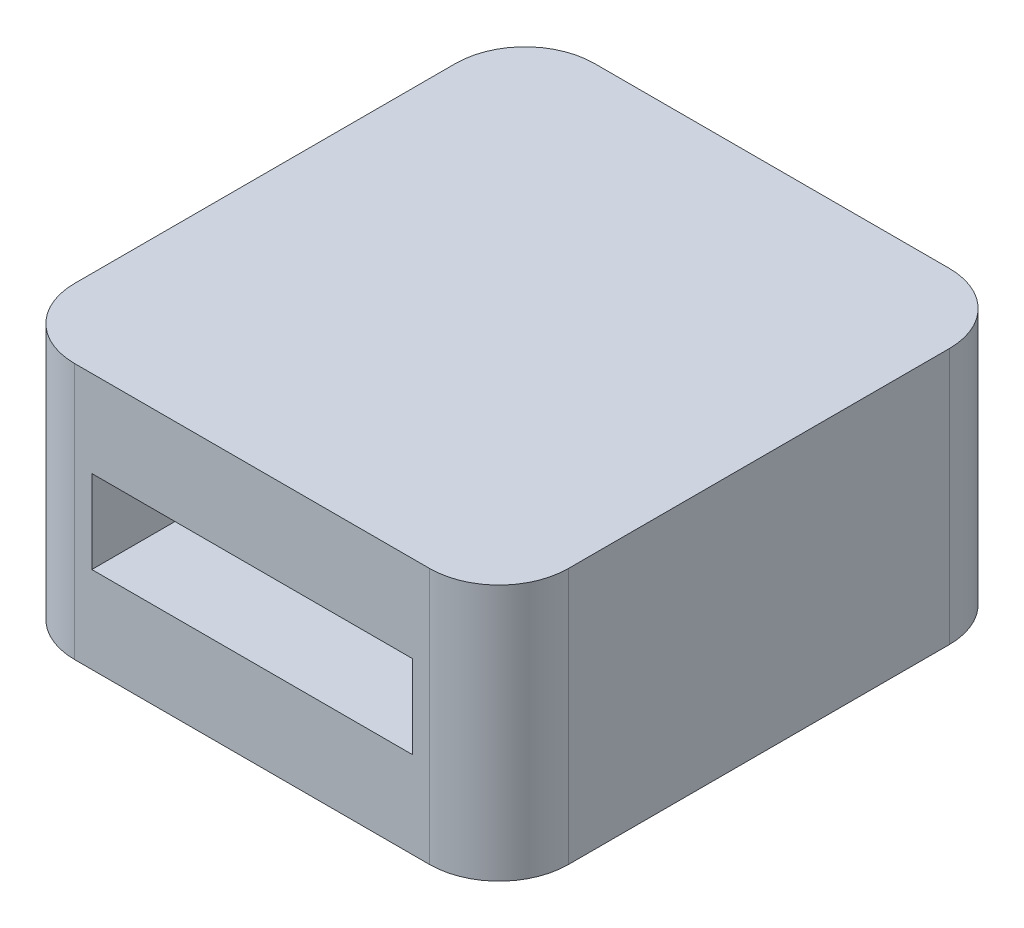
from build123d import *

# Parameters (mm, degrees)
PROFILE_SKETCH_W      = 14.25
PROFILE_SKETCH_H      = 7.4
PROFILE_SKETCH_W_2    = 9.25
PROFILE_SKETCH_H_2    = 2.4
PROFILE_EXTRUDE_DEPTH = 15
CORNER_FILLETS_R      = 2


with BuildPart() as part:
    # Profile Sketch → Profile Extrude (new body)
    with BuildSketch(Plane.XY):
        Rectangle(PROFILE_SKETCH_W, PROFILE_SKETCH_H)
        Rectangle(PROFILE_SKETCH_W_2, PROFILE_SKETCH_H_2, mode=Mode.SUBTRACT)
    extrude(amount=PROFILE_EXTRUDE_DEPTH)

    # Corner Fillets
    corner_fillets_edges = [part.edges().sort_by_distance(p)[0] for p in [
        (-7.125, 0, 0),
        (7.125, 0, 0),
        (7.125, 0, 15),
        (-7.125, 0, 15),
    ]]
    fillet(corner_fillets_edges, radius=CORNER_FILLETS_R)


solid = part.part
